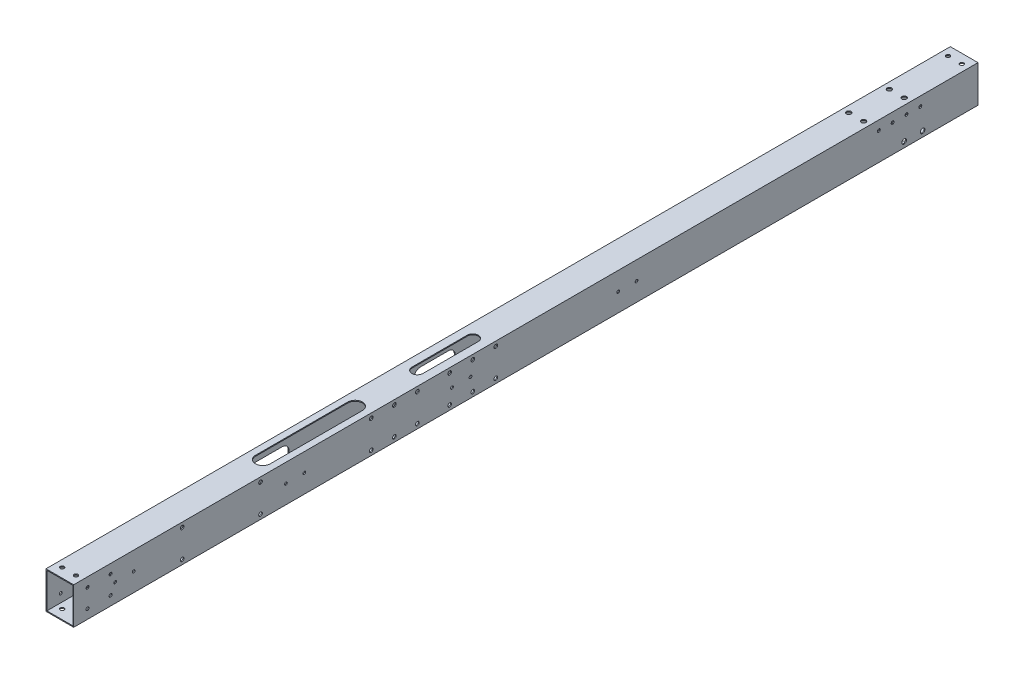
from build123d import *

# Parameters (mm, degrees)
SKETCH_1_W           = 30
SKETCH_1_H           = 40
SKETCH_1_W_2         = 28
SKETCH_1_H_2         = 38
EXTRUDE_1_DEPTH      = 940
SKETCH_5_R           = 2.5
CUT_EXTRUDE_3_DEPTH  = 941.97024395
CUT_EXTRUDE_4_DEPTH  = 1
SKETCH_7_R           = 1.5
CUT_EXTRUDE_5_DEPTH  = 1
SKETCH_17_W          = 30
SKETCH_17_H          = 40
SKETCH_17_W_2        = 28
SKETCH_17_H_2        = 38
EXTRUDE_2_DEPTH      = 20
SKETCH_18_W          = 30
SKETCH_18_H          = 40
SKETCH_18_W_2        = 28
SKETCH_18_H_2        = 38
EXTRUDE_3_DEPTH      = 20
SKETCH_19_R          = 2.1
CUT_EXTRUDE_16_DEPTH = 961.950050731
SKETCH_20_R          = 1.6
CUT_EXTRUDE_17_DEPTH = 961.67684473
SKETCH_21_R          = 2.5
SKETCH_21_R_2        = 1.6
CUT_EXTRUDE_18_DEPTH = 961.67684473
SKETCH_23_R          = 2.5
CUT_EXTRUDE_19_DEPTH = 961.950050731
SKETCH_24_R          = 4.5
CUT_EXTRUDE_20_DEPTH = 10
SKETCH_25_W          = 114.67616049
SKETCH_25_H          = 1154.562704257
CUT_EXTRUDE_21_DEPTH = 968.690549711
SKETCH_26_R          = 2
CUT_EXTRUDE_22_DEPTH = 961.67684473
CUT_EXTRUDE_23_DEPTH = 10
SKETCH_28_R          = 1.5
CUT_EXTRUDE_24_DEPTH = 10
SKETCH_29_R          = 1.5
CUT_EXTRUDE_25_DEPTH = 10
CUT_EXTRUDE_26_DEPTH = 10
SKETCH_31_R          = 1.75
CUT_EXTRUDE_27_DEPTH = 10


with BuildPart() as part:
    # 草图1 → 凸台-拉伸1 (new body)
    with BuildSketch(Plane.XY):
        Rectangle(SKETCH_1_W, SKETCH_1_H)
        Rectangle(SKETCH_1_W_2, SKETCH_1_H_2, mode=Mode.SUBTRACT)
    extrude(amount=EXTRUDE_1_DEPTH)

    # 草图5 → 切除-拉伸3 (cut, through all)
    with BuildSketch(Plane.XZ.offset(20)):
        with Locations((-8, 53)):
            Circle(SKETCH_5_R)
        with Locations((8, 53)):
            Circle(SKETCH_5_R)
        with Locations((-8, 97)):
            Circle(SKETCH_5_R)
        with Locations((8, 97)):
            Circle(SKETCH_5_R)
    extrude(amount=-CUT_EXTRUDE_3_DEPTH, mode=Mode.SUBTRACT)

    # 草图6 → 切除-拉伸4 (cut)
    with BuildSketch(Plane(origin=(15, 0, 0), x_dir=(0, 0, -1), z_dir=(1, 0, 0))):
        with BuildLine():
            Line((-345, -7.5), (-375, -7.5))
            ThreePointArc((-375, -7.5), (-382.5, 0), (-375, 7.5))
            Line((-375, 7.5), (-345, 7.5))
            ThreePointArc((-345, 7.5), (-337.5, 0), (-345, -7.5))
        make_face()
        with BuildLine():
            Line((-525, -7.5), (-555, -7.5))
            ThreePointArc((-555, -7.5), (-562.5, 0), (-555, 7.5))
            Line((-555, 7.5), (-525, 7.5))
            ThreePointArc((-525, 7.5), (-517.5, 0), (-525, -7.5))
        make_face()
        with BuildLine():
            Line((-705, -7.5), (-735, -7.5))
            ThreePointArc((-735, -7.5), (-742.5, 0), (-735, 7.5))
            Line((-735, 7.5), (-705, 7.5))
            ThreePointArc((-705, 7.5), (-697.5, 0), (-705, -7.5))
        make_face()
    extrude(amount=-CUT_EXTRUDE_4_DEPTH, mode=Mode.SUBTRACT)

    # 草图7 → 切除-拉伸5 (cut)
    with BuildSketch(Plane.ZY.offset(15)):
        with Locations((350, 0)):
            Circle(SKETCH_7_R)
        with Locations((370, 0)):
            Circle(SKETCH_7_R)
        with Locations((530, 0)):
            Circle(SKETCH_7_R)
        with Locations((550, 0)):
            Circle(SKETCH_7_R)
        with Locations((710, 0)):
            Circle(SKETCH_7_R)
        with Locations((730, 0)):
            Circle(SKETCH_7_R)
    extrude(amount=-CUT_EXTRUDE_5_DEPTH, mode=Mode.SUBTRACT)

    # 草图17 → 凸台-拉伸2 (add)
    with BuildSketch(Plane.XY.offset(940)):
        Rectangle(SKETCH_17_W, SKETCH_17_H)
        Rectangle(SKETCH_17_W_2, SKETCH_17_H_2, mode=Mode.SUBTRACT)
    extrude(amount=EXTRUDE_2_DEPTH)

    # 草图18 → 凸台-拉伸3 (add)
    with BuildSketch(Plane(origin=(0, 0, 0), x_dir=(-1, 0, 0), z_dir=(0, 0, -1))):
        Rectangle(SKETCH_18_W, SKETCH_18_H)
        Rectangle(SKETCH_18_W_2, SKETCH_18_H_2, mode=Mode.SUBTRACT)
    extrude(amount=EXTRUDE_3_DEPTH)

    # 草图19 → 切除-拉伸16 (cut, through all)
    with BuildSketch(Plane(origin=(0, 20, 0), x_dir=(1, 0, 0), z_dir=(0, 1, 0))):
        with Locations((-7.5, -950)):
            Circle(SKETCH_19_R)
        with Locations((7.5, -950)):
            Circle(SKETCH_19_R)
        with Locations((-7.5, 10)):
            Circle(SKETCH_19_R)
        with Locations((7.5, 10)):
            Circle(SKETCH_19_R)
    extrude(amount=-CUT_EXTRUDE_16_DEPTH, mode=Mode.SUBTRACT)

    # 草图20 → 切除-拉伸17 (cut, through all)
    with BuildSketch(Plane(origin=(15, 0, 0), x_dir=(0, 0, -1), z_dir=(1, 0, 0))):
        with Locations((-945, 10)):
            Circle(SKETCH_20_R)
        with Locations((-920, 10)):
            Circle(SKETCH_20_R)
        with Locations((-920, -10)):
            Circle(SKETCH_20_R)
        with Locations((-945, -10)):
            Circle(SKETCH_20_R)
    extrude(amount=-CUT_EXTRUDE_17_DEPTH, mode=Mode.SUBTRACT)

    # 草图21 → 切除-拉伸18 (cut, through all)
    with BuildSketch(Plane(origin=(15, 0, 0), x_dir=(0, 0, -1), z_dir=(1, 0, 0))):
        with Locations((-40, -14)):
            Circle(SKETCH_21_R)
        with Locations((-60, -14)):
            Circle(SKETCH_21_R)
        with Locations((-42.5, 10)):
            Circle(SKETCH_21_R_2)
        with Locations((-57.5, 10)):
            Circle(SKETCH_21_R_2)
        with Locations((-72.5, 10)):
            Circle(SKETCH_21_R_2)
        with Locations((-87.5, 10)):
            Circle(SKETCH_21_R_2)
    extrude(amount=-CUT_EXTRUDE_18_DEPTH, mode=Mode.SUBTRACT)

    # 草图23 → 切除-拉伸19 (cut, through all)
    with BuildSketch(Plane(origin=(0, 20, 0), x_dir=(1, 0, 0), z_dir=(0, 1, 0))):
        with Locations((0, -520)):
            Circle(SKETCH_23_R)
        with Locations((0, -535)):
            Circle(SKETCH_23_R)
        with Locations((0, -550)):
            Circle(SKETCH_23_R)
        with Locations((0, -565)):
            Circle(SKETCH_23_R)
    extrude(amount=-CUT_EXTRUDE_19_DEPTH, mode=Mode.SUBTRACT)

    # 草图24 → 切除-拉伸20 (cut)
    with BuildSketch(Plane(origin=(0, 20, 0), x_dir=(1, 0, 0), z_dir=(0, 1, 0))):
        with Locations((0, -520)):
            Circle(SKETCH_24_R)
        with Locations((0, -535)):
            Circle(SKETCH_24_R)
        with Locations((0, -550)):
            Circle(SKETCH_24_R)
        with Locations((0, -565)):
            Circle(SKETCH_24_R)
    extrude(amount=-CUT_EXTRUDE_20_DEPTH, mode=Mode.SUBTRACT)


with BuildPart() as body_2:
    # 镜向2: mirrored copy
    add(part.part.mirror(Plane(origin=(-50, 0, 0), x_dir=(0, 0, 1), z_dir=(1, 0, 0))))

    # 草图26 → 切除-拉伸22 (cut, through all)
    with BuildSketch(Plane.ZY.offset(115)):
        with Locations((612.5, 15)):
            Circle(SKETCH_26_R)
        with Locations((612.5, -15)):
            Circle(SKETCH_26_R)
        with Locations((527.5, 15)):
            Circle(SKETCH_26_R)
        with Locations((527.5, -15)):
            Circle(SKETCH_26_R)
        with Locations((842.5, 15)):
            Circle(SKETCH_26_R)
        with Locations((842.5, -15)):
            Circle(SKETCH_26_R)
        with Locations((757.5, 15)):
            Circle(SKETCH_26_R)
        with Locations((757.5, -15)):
            Circle(SKETCH_26_R)
        with Locations((637.5, 15)):
            Circle(SKETCH_26_R)
        with Locations((637.5, -15)):
            Circle(SKETCH_26_R)
        with Locations((552.5, -15)):
            Circle(SKETCH_26_R)
        with Locations((552.5, 15)):
            Circle(SKETCH_26_R)
        with Locations((502.5, 15)):
            Circle(SKETCH_26_R)
        with Locations((502.5, -15)):
            Circle(SKETCH_26_R)
        with Locations((587.5, -15)):
            Circle(SKETCH_26_R)
        with Locations((587.5, 15)):
            Circle(SKETCH_26_R)
    extrude(amount=-CUT_EXTRUDE_22_DEPTH, mode=Mode.SUBTRACT)

    # 草图27 → 切除-拉伸23 (cut)
    with BuildSketch(Plane(origin=(0, 20, 0), x_dir=(1, 0, 0), z_dir=(0, 1, 0))):
        with BuildLine():
            Line((-94, -512.5), (-94, -572.5))
            ThreePointArc((-94, -572.5), (-100, -578.5), (-106, -572.5))
            Line((-106, -572.5), (-106, -512.5))
            ThreePointArc((-106, -512.5), (-100, -506.5), (-94, -512.5))
        make_face()
    extrude(amount=-CUT_EXTRUDE_23_DEPTH, mode=Mode.SUBTRACT)

    # 草图28 → 切除-拉伸24 (cut)
    with BuildSketch(Plane(origin=(-85, 0, 0), x_dir=(0, 0, -1), z_dir=(1, 0, 0))):
        with Locations((-730, 0)):
            Circle(SKETCH_28_R)
        with Locations((-710, 0)):
            Circle(SKETCH_28_R)
        with Locations((-915, 0)):
            Circle(SKETCH_28_R)
        with Locations((-895, 0)):
            Circle(SKETCH_28_R)
    extrude(amount=-CUT_EXTRUDE_24_DEPTH, mode=Mode.SUBTRACT)

    # 草图29 → 切除-拉伸25 (cut)
    with BuildSketch(Plane.XZ.offset(20)):
        with Locations((-105, 740)):
            Circle(SKETCH_29_R)
        with Locations((-105, 720)):
            Circle(SKETCH_29_R)
        with Locations((-105, 700)):
            Circle(SKETCH_29_R)
        with Locations((-105, 680)):
            Circle(SKETCH_29_R)
        with Locations((-105, 660)):
            Circle(SKETCH_29_R)
        with Locations((-105, 640)):
            Circle(SKETCH_29_R)
        with Locations((-105, 620)):
            Circle(SKETCH_29_R)
    extrude(amount=-CUT_EXTRUDE_25_DEPTH, mode=Mode.SUBTRACT)

    # 草图30 → 切除-拉伸26 (cut)
    with BuildSketch(Plane(origin=(0, 20, 0), x_dir=(1, 0, 0), z_dir=(0, 1, 0))):
        with BuildLine():
            Line((-92, -640), (-92, -740))
            ThreePointArc((-92, -740), (-100, -748), (-108, -740))
            Line((-108, -740), (-108, -640))
            ThreePointArc((-108, -640), (-100, -632), (-92, -640))
        make_face()
    extrude(amount=-CUT_EXTRUDE_26_DEPTH, mode=Mode.SUBTRACT)

    # 草图31 → 切除-拉伸27 (cut)
    with BuildSketch(Plane.XZ.offset(20)):
        with Locations((-100, 117)):
            Circle(SKETCH_31_R)
        with Locations((-100, 137)):
            Circle(SKETCH_31_R)
    extrude(amount=-CUT_EXTRUDE_27_DEPTH, mode=Mode.SUBTRACT)


with BuildPart() as part_1:
    add(part.part)

    # 草图25 → 切除-拉伸21 (cut, through all)
    with BuildSketch(Plane(origin=(0, 20, 0), x_dir=(1, 0, 0), z_dir=(0, 1, 0))):
        with Locations((7.338080245, -506.215166959)):
            Rectangle(SKETCH_25_W, SKETCH_25_H)
    extrude(amount=-CUT_EXTRUDE_21_DEPTH, mode=Mode.SUBTRACT)


solid = body_2.part
